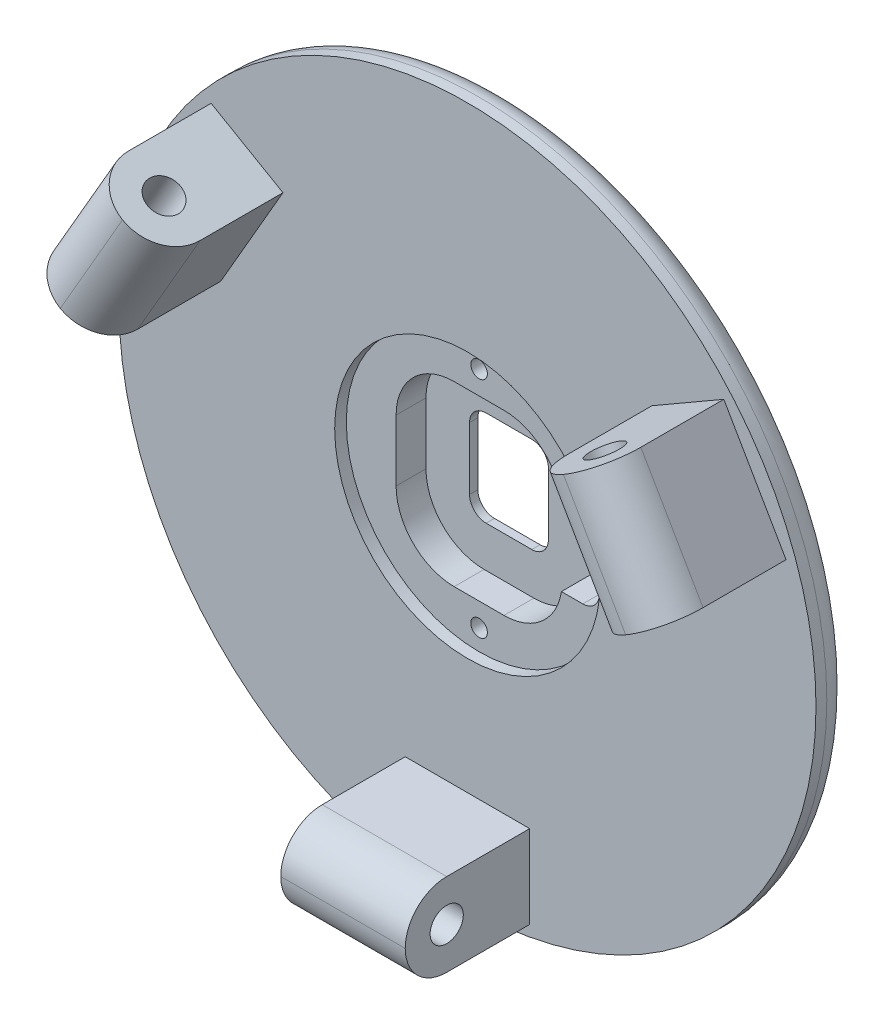
from build123d import *

# Parameters (mm, degrees)
BOSS_EXTRUDE1_DEPTH = 6
SKETCH3_R           = 3
CUT_EXTRUDE1_DEPTH  = 43.330607543
SKETCH8_W           = 20
SKETCH8_H           = 21.4
CUT_EXTRUDE5_DEPTH  = 5
FILLET8_R           = 7
SKETCH9_R           = 1
CUT_EXTRUDE6_DEPTH  = 43.330607543
SKETCH10_W          = 9.5
SKETCH10_H          = 11.5
CUT_EXTRUDE7_DEPTH  = 43.200477899
FILLET9_R           = 2
SKETCH11_W          = 5.5
SKETCH11_H          = 9.5
CUT_EXTRUDE8_DEPTH  = 5
FILLET10_R          = 2
SKETCH12_R          = 16
CUT_EXTRUDE9_DEPTH  = 1.4
SKETCH13_R          = 2.5
CUT_EXTRUDE10_DEPTH = 2.4
SKETCH14_R          = 42
BOSS_EXTRUDE3_DEPTH = 6
CHAMFER1_SIZE       = 2.6
CHAMFER1_SIZE2      = 7.143441291
FILLET12_R          = 3
SKETCH15_W          = 15
SKETCH15_H          = 10
BOSS_EXTRUDE4_DEPTH = 15
SKETCH16_R          = 2
CUT_EXTRUDE11_DEPTH = 15
SKETCH17_R          = 2
CUT_EXTRUDE12_DEPTH = 15
SKETCH18_R          = 2
CUT_EXTRUDE13_DEPTH = 15
FILLET13_R          = 5


with BuildPart() as part:
    # Sketch1 → Boss-Extrude1 (new body)
    with BuildSketch(Plane.XY):
        Polygon((-11.547005384, 20), (-5.63450733, 30.24074703), (5.63450733, 30.24074703), (5.773502692, 30), (23.094010768, 0), (29.006508822, -10.24074703), (23.372001492, -20), (23.094010768, -20), (-11.547005384, -20), (-23.372001492, -20), (-29.006508822, -10.24074703), (-28.867513459, -10), align=None)
    extrude(amount=BOSS_EXTRUDE1_DEPTH)

    # Sketch3 → Cut-Extrude1 (cut, through all)
    with BuildSketch(Plane.XY.offset(6)):
        Circle(SKETCH3_R)
    extrude(amount=-CUT_EXTRUDE1_DEPTH, mode=Mode.SUBTRACT)

    # Sketch8 → Cut-Extrude5 (cut)
    with BuildSketch(Plane.XY.offset(6)):
        Rectangle(SKETCH8_W, SKETCH8_H)
    extrude(amount=-CUT_EXTRUDE5_DEPTH, mode=Mode.SUBTRACT)

    # Fillet8
    fillet8_edges = [part.edges().sort_by_distance(p)[0] for p in [
        (10, 10.7, 3.5),
        (10, -10.7, 3.5),
        (-10, -10.7, 3.5),
        (-10, 10.7, 3.5),
    ]]
    fillet(fillet8_edges, radius=FILLET8_R)

    # Sketch9 → Cut-Extrude6 (cut, through all)
    with BuildSketch(Plane.XY.offset(6)):
        with Locations((0, 13.5)):
            Circle(SKETCH9_R)
        with Locations(Location((0, -13.5, 0), (0, 0, 180))):
            Circle(SKETCH9_R)
    extrude(amount=-CUT_EXTRUDE6_DEPTH, mode=Mode.SUBTRACT)

    # Sketch10 → Cut-Extrude7 (cut, through all)
    with BuildSketch(Plane.XY.offset(1)):
        Rectangle(SKETCH10_W, SKETCH10_H)
    extrude(amount=-CUT_EXTRUDE7_DEPTH, mode=Mode.SUBTRACT)

    # Fillet9
    fillet9_edges = [part.edges().sort_by_distance(p)[0] for p in [
        (4.75, 5.75, 0.5),
        (4.75, -5.75, 0.5),
        (-4.75, -5.75, 0.5),
        (-4.75, 5.75, 0.5),
    ]]
    fillet(fillet9_edges, radius=FILLET9_R)

    # Sketch11 → Cut-Extrude8 (cut)
    with BuildSketch(Plane.XY.offset(6)):
        with Locations((11.75, 0)):
            Rectangle(SKETCH11_W, SKETCH11_H)
    extrude(amount=-CUT_EXTRUDE8_DEPTH, mode=Mode.SUBTRACT)

    # Fillet10
    fillet10_edges = [part.edges().sort_by_distance(p)[0] for p in [
        (14.5, -4.75, 3.5),
        (14.5, 4.75, 3.5),
    ]]
    fillet(fillet10_edges, radius=FILLET10_R)

    # Sketch12 → Cut-Extrude9 (cut)
    with BuildSketch(Plane.XY.offset(6)):
        Circle(SKETCH12_R)
    extrude(amount=-CUT_EXTRUDE9_DEPTH, mode=Mode.SUBTRACT)

    # Sketch13 → Cut-Extrude10 (cut)
    with BuildSketch(Plane(origin=(0, 0, 0), x_dir=(-1, 0, 0), z_dir=(0, 0, -1))):
        with Locations((0, 13.5)):
            Circle(SKETCH13_R)
        with Locations((0, -13.5)):
            Circle(SKETCH13_R)
    extrude(amount=-CUT_EXTRUDE10_DEPTH, mode=Mode.SUBTRACT)

    # Sketch14 → Boss-Extrude3 (add)
    with BuildSketch(Plane(origin=(0, 0, 0), x_dir=(-1, 0, 0), z_dir=(0, 0, -1))):
        Circle(SKETCH14_R)
        Polygon((19.538701505, 0), (9.769350753, 16.921011861), (-9.769350753, 16.921011861), (-19.538701505, 0), (-9.769350753, -16.921011861), (9.769350753, -16.921011861), align=None, mode=Mode.SUBTRACT)
    extrude(amount=-BOSS_EXTRUDE3_DEPTH)

    # Chamfer1
    chamfer1_edges = [part.edges().sort_by_distance(p)[0] for p in [
        (42, 0, 0),
    ]]
    chamfer1_side = [part.faces().sort_by_distance(p)[0] for p in [
        (42, 0, 3),
    ]]
    chamfer(chamfer1_edges, length=CHAMFER1_SIZE, length2=CHAMFER1_SIZE2, reference=chamfer1_side[0])

    # Fillet12
    fillet12_edges = [part.edges().sort_by_distance(p)[0] for p in [
        (34.856558709, 0, 0),
        (42, 0, 2.6),
    ]]
    fillet(fillet12_edges, radius=FILLET12_R)

    # Sketch15 → Boss-Extrude4 (add)
    with BuildSketch(Plane.XY.offset(6)):
        Polygon((-29.730762114, 8.504809472), (-22.230762114, 21.495190528), (-30.891016151, 26.495190528), (-38.391016151, 13.504809472), align=None)
        with Locations((0, -35)):
            Rectangle(SKETCH15_W, SKETCH15_H)
        Polygon((22.230762114, 21.495190528), (29.730762114, 8.504809472), (38.391016151, 13.504809472), (30.891016151, 26.495190528), align=None)
    extrude(amount=BOSS_EXTRUDE4_DEPTH)

    # Sketch16 → Cut-Extrude11 (cut)
    with BuildSketch(Plane(origin=(-3.75, 6.495190528, 0), x_dir=(0.8660254037844431, 0.49999999999999234, 0), z_dir=(-0.4999999999999924, 0.8660254037844431, 0))):
        with Locations(Location((35, -16, 0), (0, 0, 180))):
            Circle(SKETCH16_R)
    extrude(amount=-CUT_EXTRUDE11_DEPTH, mode=Mode.SUBTRACT)

    # Sketch17 → Cut-Extrude12 (cut)
    with BuildSketch(Plane(origin=(7.5, 0, 0), x_dir=(0, 0, -1), z_dir=(1, 0, 0))):
        with Locations(Location((-16, -35, 0), (0, 0, 90))):
            Circle(SKETCH17_R)
    extrude(amount=-CUT_EXTRUDE12_DEPTH, mode=Mode.SUBTRACT)

    # Sketch18 → Cut-Extrude13 (cut)
    with BuildSketch(Plane(origin=(3.75, 6.495190528, 0), x_dir=(0.8660254037844364, -0.5000000000000041, 0), z_dir=(0.500000000000004, 0.8660254037844363, 0))):
        with Locations(Location((-35, -16, 0), (0, 0, 180))):
            Circle(SKETCH18_R)
    extrude(amount=-CUT_EXTRUDE13_DEPTH, mode=Mode.SUBTRACT)

    # Fillet13
    fillet13_edges = [part.edges().sort_by_distance(p)[0] for p in [
        (0, -40, 21),
        (0, -30, 21),
        (-34.641016151, 20, 21),
        (-25.980762114, 15, 21),
        (25.980762114, 15, 21),
        (34.641016151, 20, 21),
    ]]
    fillet(fillet13_edges, radius=FILLET13_R - 0.0001)  # a hair under: the kernel refuses the full size


solid = part.part
